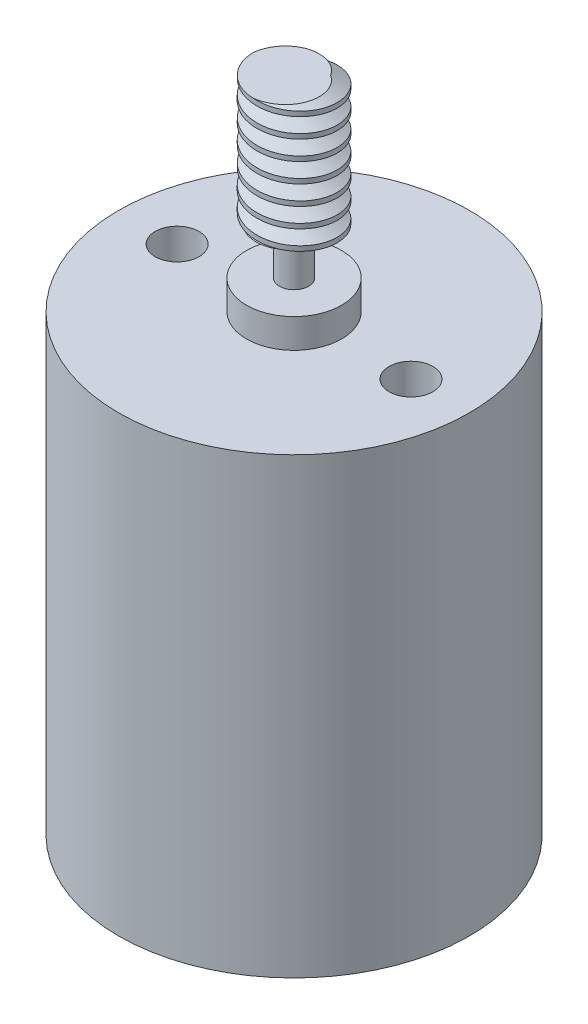
from build123d import *

# Parameters (mm, degrees)
SKETCH1_R           = 12
BOSS_EXTRUDE1_DEPTH = 31
SKETCH2_R           = 1.5
CUT_EXTRUDE1_DEPTH  = 5
SKETCH3_R           = 3.25
BOSS_EXTRUDE2_DEPTH = 2
SKETCH4_R           = 1
BOSS_EXTRUDE3_DEPTH = 12
SKETCH5_R           = 2.75
BOSS_EXTRUDE4_DEPTH = 9
CUT_SWEEP6_PITCH    = 1.33


with BuildPart() as part:
    # Sketch1 → Boss-Extrude1 (new body)
    with BuildSketch(Plane(origin=(0, 0, 0), x_dir=(1, 0, 0), z_dir=(0, 1, 0))):
        with Locations(Location((0, 0, 0), (0, 0, 270))):
            Circle(SKETCH1_R)
    extrude(amount=BOSS_EXTRUDE1_DEPTH)

    # Sketch2 → Cut-Extrude1 (cut)
    with BuildSketch(Plane(origin=(0, 31, 0), x_dir=(1, 0, 0), z_dir=(0, 1, 0))):
        with Locations(Location((8, 0, 0), (0, 0, 270))):
            Circle(SKETCH2_R)
        with Locations(Location((-8, 0, 0), (0, 0, 270))):
            Circle(SKETCH2_R)
    extrude(amount=-CUT_EXTRUDE1_DEPTH, mode=Mode.SUBTRACT)

    # Sketch3 → Boss-Extrude2 (add)
    with BuildSketch(Plane(origin=(0, 31, 0), x_dir=(1, 0, 0), z_dir=(0, 1, 0))):
        with Locations(Location((0, 0, 0), (0, 0, 270))):
            Circle(SKETCH3_R)
    extrude(amount=BOSS_EXTRUDE2_DEPTH)

    # Sketch4 → Boss-Extrude3 (add)
    with BuildSketch(Plane(origin=(0, 33, 0), x_dir=(1, 0, 0), z_dir=(0, 1, 0))):
        with Locations(Location((0, 0, 0), (0, 0, 270))):
            Circle(SKETCH4_R)
    extrude(amount=BOSS_EXTRUDE3_DEPTH)

    # Sketch5 → Boss-Extrude4 (add)
    with BuildSketch(Plane(origin=(0, 45, 0), x_dir=(1, 0, 0), z_dir=(0, 1, 0))):
        with Locations(Location((0, 0, 0), (0, 0, 270))):
            Circle(SKETCH5_R)
    extrude(amount=-BOSS_EXTRUDE4_DEPTH)

    # Cut-Sweep6: arcs per turn and ends read off the stored shape
    # Cut-Sweep6: the profile of Sketch6 profile screwed along a left-hand helix through 9 turns, 8 arcs to a turn; built about Z, then put on its axis
    cut_sweep6_z = Axis((0, 0, 0), (0, 0, 1))
    cut_sweep6_corners = [(2.7503, 0, -1.330152512), (1.766472482, 0, -0.83), (2.7503, 0, -0.329847488)]
    with BuildLine(mode=Mode.PRIVATE) as cut_sweep6_profile:
        Line(cut_sweep6_corners[0], cut_sweep6_corners[1])
        Line(cut_sweep6_corners[1], cut_sweep6_corners[2])
        Line(cut_sweep6_corners[2], cut_sweep6_corners[0])
    cut_sweep6_cap = Face(cut_sweep6_profile.wire())
    cut_sweep6_turn_angles = [0, -22.5, -45, -67.5, -90, -112.5, -135, -157.5, -180, -202.5, -225, -247.5, -270, -292.5, -315, -337.5, -360]
    cut_sweep6_turn_weights = [1, 0.9238795325112867, 1, 0.9238795325112867, 1, 0.9238795325112867, 1, 0.9238795325112867, 1, 0.9238795325112867, 1, 0.9238795325112867, 1, 0.9238795325112867, 1, 0.9238795325112867, 1]
    cut_sweep6_turn_rails = [Edge.make_bspline([Vector(p[0], p[1], 0).rotate(cut_sweep6_z, cut_sweep6_turn_angles[k]) / cut_sweep6_turn_weights[k] + Vector(0, 0, p[2] + -CUT_SWEEP6_PITCH * cut_sweep6_turn_angles[k] / 360) for k in range(17)], [0, 0, 0, 1, 1, 2, 2, 3, 3, 4, 4, 5, 5, 6, 6, 7, 7, 8, 8, 8], 2, cut_sweep6_turn_weights) for p in cut_sweep6_corners]
    cut_sweep6_turn_sides = [Face.make_surface_from_curves(cut_sweep6_turn_rails[p[0]], cut_sweep6_turn_rails[p[1]]) for p in [(0, 1), (1, 2), (2, 0)]]
    cut_sweep6 = Plane(origin=(0, 45, 0), x_dir=(-1, 0, 0), z_dir=(0, -1, 0)) * Solid(Shell([*[p.moved(Location((0, 0, CUT_SWEEP6_PITCH * i))) for i in range(9) for p in cut_sweep6_turn_sides], cut_sweep6_cap, cut_sweep6_cap.rotate(cut_sweep6_z, -3240).moved(Location((0, 0, -CUT_SWEEP6_PITCH * -3240 / 360)))]))
    add(cut_sweep6, mode=Mode.SUBTRACT)


solid = part.part
